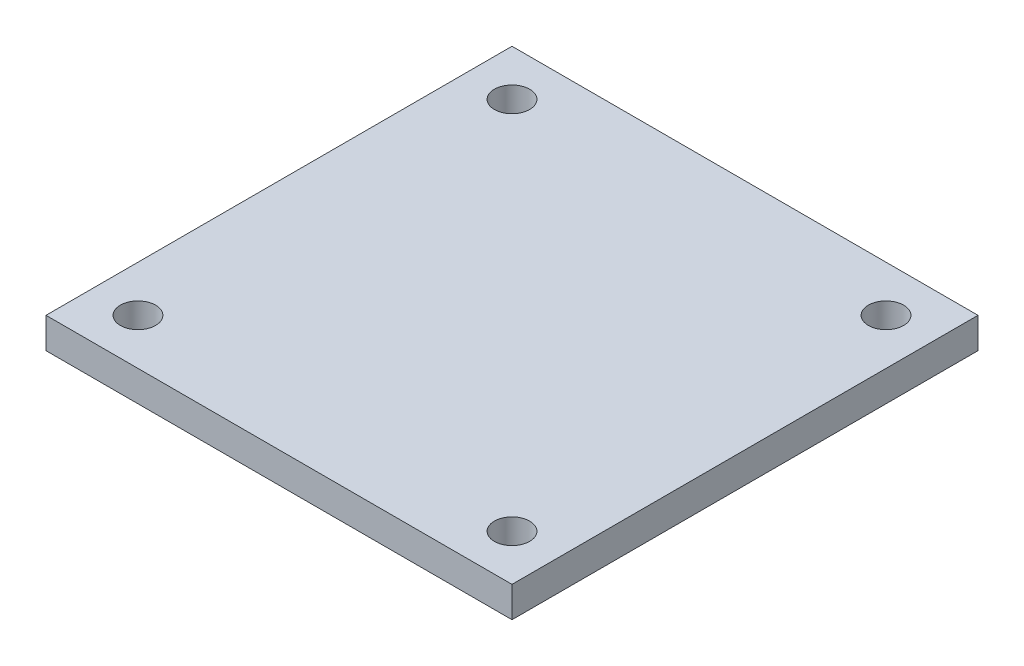
from build123d import *

# Parameters (mm, degrees)
SKETCH1_W           = 30.4
SKETCH1_H           = 30.4
SKETCH1_R           = 1.15
BOSS_EXTRUDE1_DEPTH = 2


with BuildPart() as part:
    # Sketch1 → Boss-Extrude1 (new body)
    with BuildSketch(Plane(origin=(0, 0, 0), x_dir=(1, 0, 0), z_dir=(0, 1, 0))):
        Rectangle(SKETCH1_W, SKETCH1_H)
        with Locations((-12.2, 12.2)):
            Circle(SKETCH1_R, mode=Mode.SUBTRACT)
        with Locations((12.2, 12.2)):
            Circle(SKETCH1_R, mode=Mode.SUBTRACT)
        with Locations((12.2, -12.2)):
            Circle(SKETCH1_R, mode=Mode.SUBTRACT)
        with Locations((-12.2, -12.2)):
            Circle(SKETCH1_R, mode=Mode.SUBTRACT)
    extrude(amount=BOSS_EXTRUDE1_DEPTH)


solid = part.part
